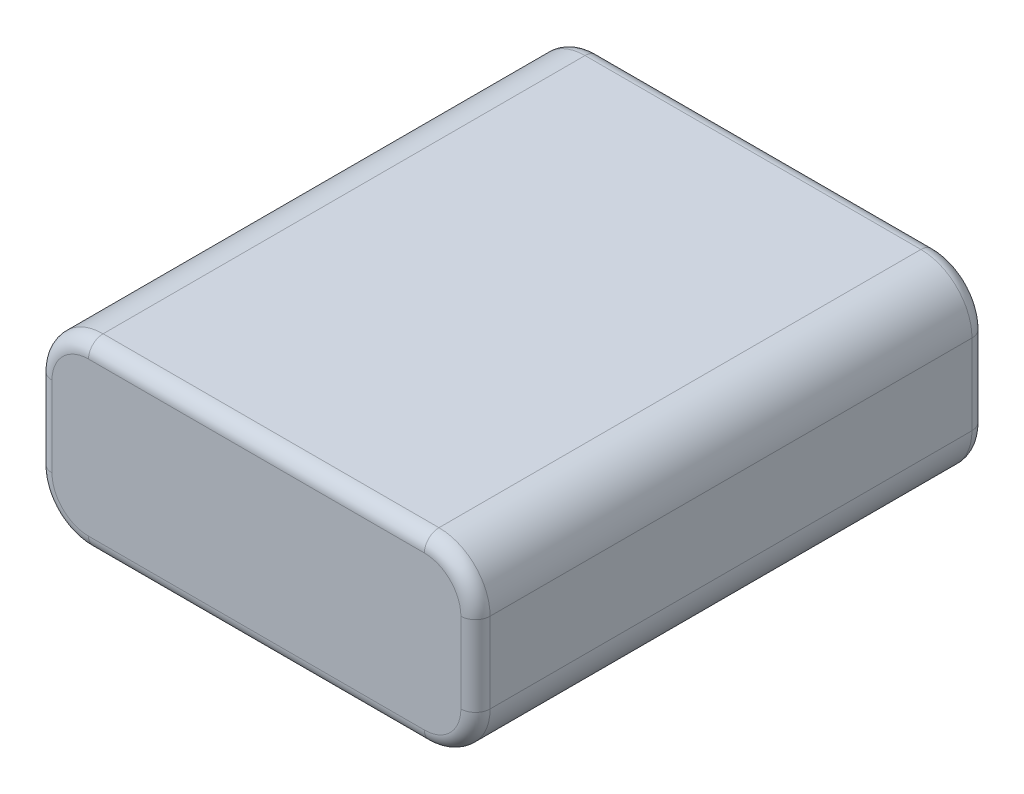
from build123d import *

# Parameters (mm, degrees)
BOSS_EXTRUDE1_DEPTH = 70
FILLET1_R           = 2


with BuildPart() as part:
    # Sketch1 → Boss-Extrude1 (new body)
    with BuildSketch(Plane.XY):
        with BuildLine():
            Line((7, 0), (53, 0))
            ThreePointArc((53, 0), (57.949747468, 2.050252532), (60, 7))
            Line((60, 7), (60, 18))
            ThreePointArc((60, 18), (57.949747468, 22.949747468), (53, 25))
            Line((53, 25), (7, 25))
            ThreePointArc((7, 25), (2.050252532, 22.949747468), (0, 18))
            Line((0, 18), (0, 7))
            ThreePointArc((0, 7), (2.050252532, 2.050252532), (7, 0))
        make_face()
    extrude(amount=BOSS_EXTRUDE1_DEPTH)

    # Fillet1
    fillet1_edges = [part.edges().sort_by_distance(p)[0] for p in [
        (30, 25, 0),
        (2.050252532, 22.949747468, 0),
        (0, 12.5, 0),
        (2.050252532, 2.050252532, 0),
        (30, 0, 0),
        (57.949747468, 2.050252532, 0),
        (60, 12.5, 0),
        (57.949747468, 22.949747468, 0),
        (60, 12.5, 70),
        (57.949747468, 2.050252532, 70),
        (30, 0, 70),
        (2.050252532, 2.050252532, 70),
        (0, 12.5, 70),
        (2.050252532, 22.949747468, 70),
        (30, 25, 70),
        (57.949747468, 22.949747468, 70),
    ]]
    fillet(fillet1_edges, radius=FILLET1_R)


solid = part.part
